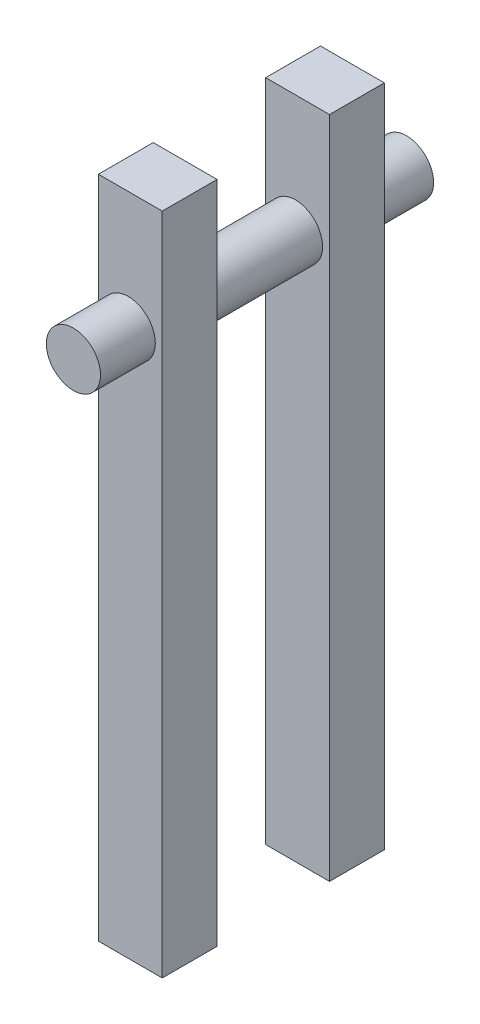
from build123d import *

# Parameters (mm, degrees)
SKETCH1_W                = 7.9
SKETCH1_H                = 95.7
BOSS_EXTRUDE1_DEPTH      = 9.2
SKETCH1_3_W              = 7.9
SKETCH1_3_H              = 95.7
BOSS_EXTRUDE2_DEPTH      = 9.2
BOSS_EXTRUDE3_DEPTH      = 32
BOSS_EXTRUDE3_DEPTH_BACK = 16
SKETCH2_R                = 3.9


with BuildPart() as part:
    # Sketch1 → Boss-Extrude1 (new body)
    with BuildSketch(Plane(origin=(0, 0, 0), x_dir=(0, 0, -1), z_dir=(1, 0, 0))):
        with Locations((-28.171698113, -0.670754717)):
            Rectangle(SKETCH1_W, SKETCH1_H)
    extrude(amount=BOSS_EXTRUDE1_DEPTH)

    # Sketch1<3> → Boss-Extrude2 (add)
    with BuildSketch(Plane(origin=(0, 0, 0), x_dir=(0, 0, -1), z_dir=(1, 0, 0))):
        with Locations((-28.171698113, -0.670754717)):
            Rectangle(SKETCH1_3_W, SKETCH1_3_H)
        with Locations((-4.071698113, -0.670754717)):
            Rectangle(SKETCH1_3_W, SKETCH1_3_H)
    extrude(amount=BOSS_EXTRUDE2_DEPTH)


with BuildPart() as boss_extrude2_piece_1:
    # of the separate pieces the step leaves, piece 1, a body of its own (boss_extrude2_pieces)
    add(part.part.solids().sort_by_distance((0, 47.179245283, 8.021698113))[0])



with BuildPart() as boss_extrude2_piece_2:
    # of the separate pieces the step leaves, piece 2, a body of its own (boss_extrude2_pieces)
    add(part.part.solids().sort_by_distance((0, 47.179245283, 32.121698113))[0])


with BuildPart() as boss_extrude2_piece_1_1:
    add(boss_extrude2_piece_1.part)

    add(boss_extrude2_piece_2.part)  # Boss-Extrude3 merges Boss-Extrude2 piece 2
    # Sketch2 → Boss-Extrude3 (add, two sides: drawn at the far end of the back side and taken through both)
    with BuildSketch(Plane.XY.offset(8.021698113).offset(-BOSS_EXTRUDE3_DEPTH_BACK)):
        with Locations((4.3, 30.179245283)):
            Circle(SKETCH2_R)
    extrude(amount=BOSS_EXTRUDE3_DEPTH + BOSS_EXTRUDE3_DEPTH_BACK)


solid = boss_extrude2_piece_1_1.part
